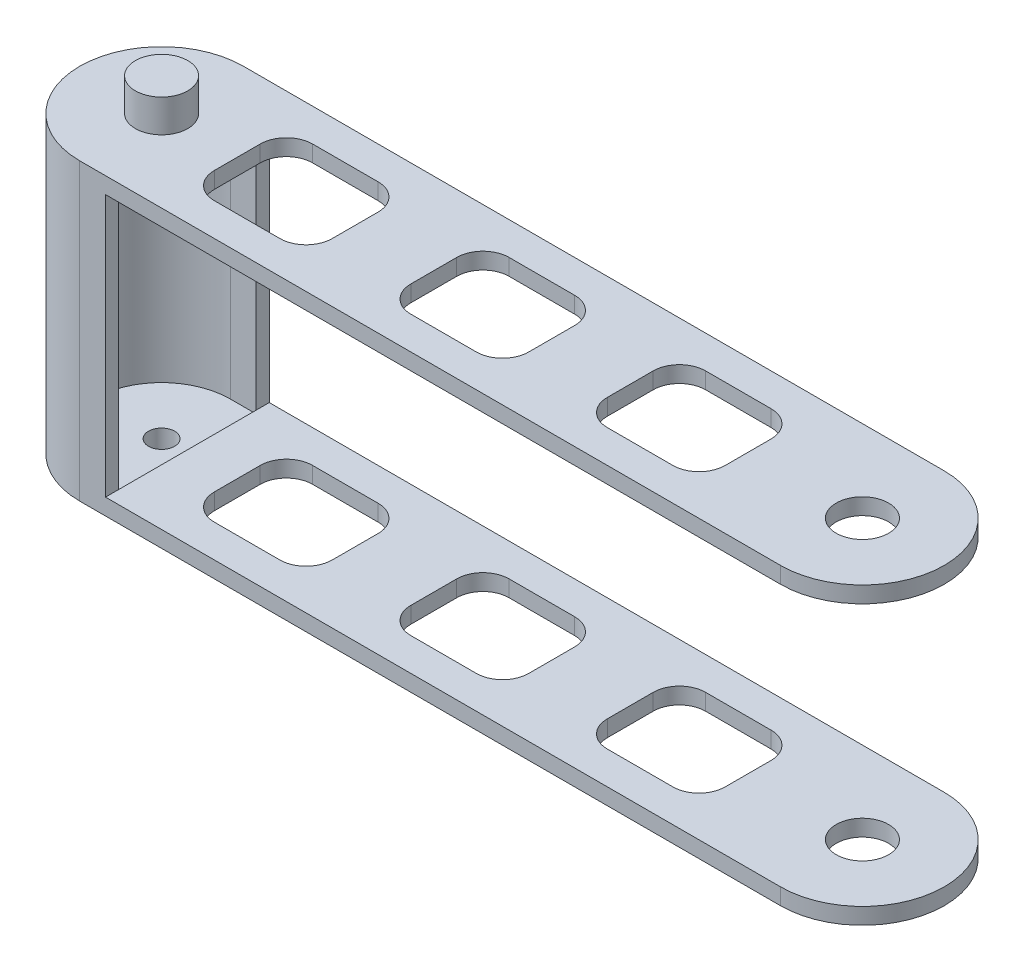
from build123d import *

# Parameters (mm, degrees)
SKETCH1_R              = 4
BOSS_EXTRUDE1_DEPTH    = 45
SKETCH2_W              = 50.339144224
SKETCH2_H              = 25
CUT_EXTRUDE1_DEPTH     = 20
SKETCH3_R              = 4
BOSS_EXTRUDE2_DEPTH    = 5
CUT_EXTRUDE2_REACH     = 88.493
SKETCH4_W              = 77.888808367
SKETCH4_H              = 40
SKETCH5_W              = 18
SKETCH5_H              = 15
CUT_EXTRUDE3_DEPTH     = 84.739178405
FILLET1_R              = 4
LPATTERN1_COUNT        = 3
LPATTERN1_PITCH        = 30
FILLET1_OF_LPATTERN1_R = 4
SHELL1_START           = 2
SHELL1_DEPTH           = 41
SHELL1_START_2         = -3
SHELL1_2_OUTLINE_R     = 2
SHELL1_2_DEPTH         = 51


# Read off the part's stored shape, not the designer's step: Shell1
with BuildPart() as part:
    # Sketch1 → Boss-Extrude1 (new body)
    with BuildSketch(Plane(origin=(0, 0, 0), x_dir=(1, 0, 0), z_dir=(0, 1, 0))):
        with BuildLine():
            Line((-53.5, -12.5), (53.5, -12.5))
            ThreePointArc((53.5, -12.5), (66, 0), (53.5, 12.5))
            Line((53.5, 12.5), (-53.5, 12.5))
            ThreePointArc((-53.5, 12.5), (-66, 0), (-53.5, -12.5))
        make_face()
        with Locations(Location((53.5, 0, 0), (0, 0, 90))):
            Circle(SKETCH1_R, mode=Mode.SUBTRACT)
    extrude(amount=BOSS_EXTRUDE1_DEPTH)

    # Sketch2 → Cut-Extrude1 (cut, symmetric)
    with BuildSketch(Plane(origin=(0, 22.5, 0), x_dir=(1, 0, 0), z_dir=(0, 1, 0))):
        with Locations((53.5, 0)):
            Rectangle(SKETCH2_W, SKETCH2_H)
    extrude(amount=CUT_EXTRUDE1_DEPTH, both=True, mode=Mode.SUBTRACT)

    # Sketch3 → Boss-Extrude2 (add, symmetric)
    with BuildSketch(Plane(origin=(0, 45, 0), x_dir=(1, 0, 0), z_dir=(0, 1, 0))):
        with Locations(Location((-53.5, 0, 0), (0, 0, 270))):
            Circle(SKETCH3_R)
    boss_extrude2 = extrude(amount=BOSS_EXTRUDE2_DEPTH, both=True)

    # Mirror1: Boss-Extrude2 across plane
    add(boss_extrude2.mirror(Plane.ZX.offset(22.5)))

    # Sketch4 → Cut-Extrude2 (cut, up to next)
    with BuildSketch(Plane(origin=(0, 0, -12.5), x_dir=(-1, 0, 0), z_dir=(0, 0, -1)), mode=Mode.PRIVATE) as cut_extrude2_sk1:
        with Locations((10.613976295, 22.5)):
            Rectangle(SKETCH4_W, SKETCH4_H)
    cut_extrude2_tool1 = extrude(cut_extrude2_sk1.sketch, amount=-CUT_EXTRUDE2_REACH, mode=Mode.PRIVATE) & part.part
    add(cut_extrude2_tool1.solids().sort_by_distance((-10.613976, 22.5, -12.5))[0], mode=Mode.SUBTRACT)

    # Sketch5 → Cut-Extrude3 (cut, through all)
    with BuildSketch(Plane(origin=(0, 45, 0), x_dir=(1, 0, 0), z_dir=(0, 1, 0))):
        with Locations((-32.941043084, 0)):
            Rectangle(SKETCH5_W, SKETCH5_H)
    cut_extrude3 = extrude(amount=-CUT_EXTRUDE3_DEPTH, mode=Mode.SUBTRACT)

    # Fillet1
    fillet1_edges = [part.edges().sort_by_distance(p)[0] for p in [
        (-41.941043084, 1.25, 7.5),
        (-41.941043084, 1.25, -7.5),
        (-23.941043084, 1.25, -7.5),
        (-23.941043084, 1.25, 7.5),
        (-41.941043084, 43.75, 7.5),
        (-41.941043084, 43.75, -7.5),
        (-23.941043084, 43.75, -7.5),
        (-23.941043084, 43.75, 7.5),
    ]]
    fillet(fillet1_edges, radius=FILLET1_R)

    # LPattern1: Cut-Extrude3 ×3
    with Locations(*[(i * LPATTERN1_PITCH, 0, 0) for i in range(1, LPATTERN1_COUNT)]):
        add(cut_extrude3, mode=Mode.SUBTRACT)

    # Fillet1 of LPattern1
    fillet1_of_lpattern1_edges = [part.edges().sort_by_distance(p)[0] for p in [
        (-11.941043084, 1.25, 7.5),
        (-11.941043084, 1.25, -7.5),
        (6.058956916, 1.25, -7.5),
        (6.058956916, 1.25, 7.5),
        (-11.941043084, 43.75, 7.5),
        (-11.941043084, 43.75, -7.5),
        (6.058956916, 43.75, -7.5),
        (6.058956916, 43.75, 7.5),
        (18.058956916, 1.25, 7.5),
        (18.058956916, 1.25, -7.5),
        (36.058956916, 1.25, -7.5),
        (36.058956916, 1.25, 7.5),
        (18.058956916, 43.75, 7.5),
        (18.058956916, 43.75, -7.5),
        (36.058956916, 43.75, -7.5),
        (36.058956916, 43.75, 7.5),
    ]]
    fillet(fillet1_of_lpattern1_edges, radius=FILLET1_OF_LPATTERN1_R)

    # Shell1 outline → Shell1 (cut)
    with BuildSketch(Plane(origin=(0, 0, 0), x_dir=(1, 0, 0), z_dir=(0, 1, 0)).offset(SHELL1_START)):
        with BuildLine():
            Line((-49.558380479, -10.5), (-49.558380479, 10.5))
            Line((-49.558380479, 10.5), (-53.5, 10.5))
            ThreePointArc((-53.5, 10.5), (-64, 0), (-53.5, -10.5))
            Line((-53.5, -10.5), (-49.558380479, -10.5))
        make_face()
    extrude(amount=SHELL1_DEPTH, mode=Mode.SUBTRACT)

    # Shell1 2 outline → Shell1 2 (cut)
    with BuildSketch(Plane(origin=(0, 0, 0), x_dir=(1, 0, 0), z_dir=(0, 1, 0)).offset(SHELL1_START_2)):
        with Locations((-53.5, 0)):
            Circle(SHELL1_2_OUTLINE_R)
    extrude(amount=SHELL1_2_DEPTH, mode=Mode.SUBTRACT)


solid = part.part
